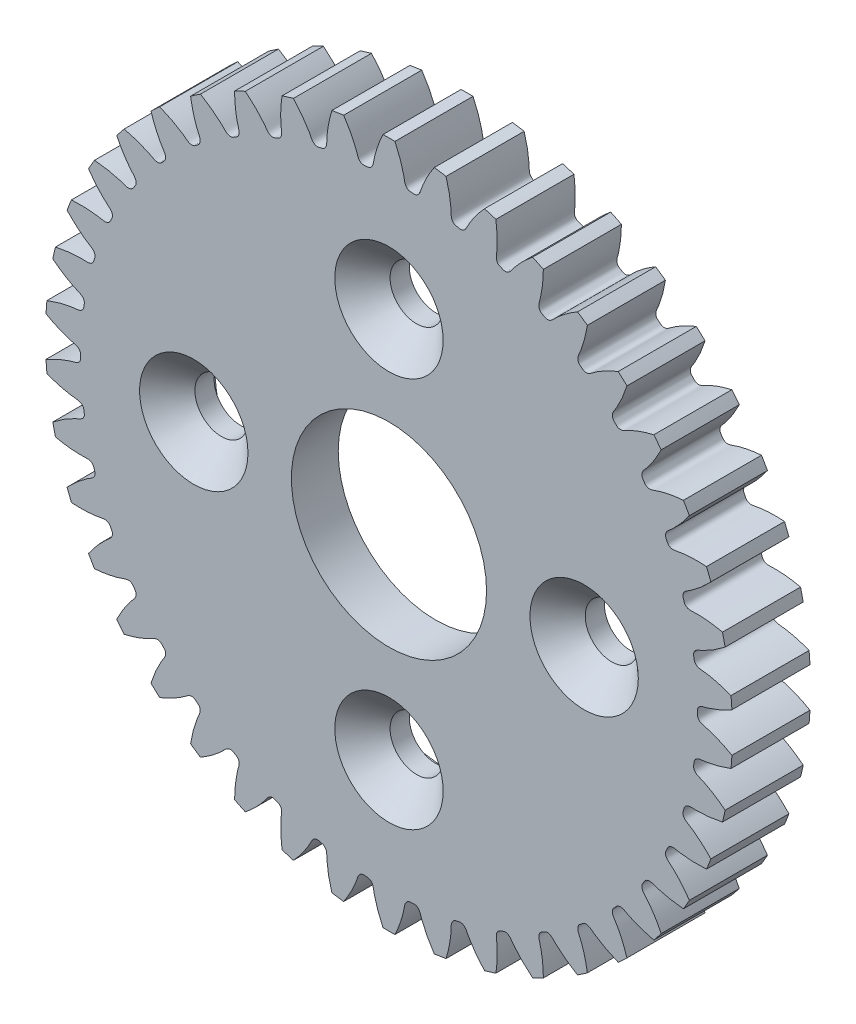
from build123d import *

# Parameters (mm, degrees)
SKETCHREVOLVESPURASSEM30_42M1GEAR_W                  = 5
SKETCHREVOLVESPURASSEM30_42M1GEAR_H                  = 21.99999967
TOOTHEXTRUDECUTSPURASSEM30_42M1GEAR_DEPTH            = 2.5
PATTERNSPURASSEM30_42M1GEAR_COUNT                    = 42
BOREREVOLVESKETCH_W                                  = 5
BOREREVOLVESKETCH_H                                  = 2.5
SKETCH1_R                                            = 16.25
CUT_EXTRUDE1_DEPTH                                   = 2
CSK_FOR_M3_HEX_SOCKET_COUNTERSUNK_HEAD_S_D           = 3.4
CSK_FOR_M3_HEX_SOCKET_COUNTERSUNK_HEAD_S_CSINK_D     = 6.94
CSK_FOR_M3_HEX_SOCKET_COUNTERSUNK_HEAD_S_CSINK_ANGLE = 90
SKETCH5_R                                            = 6.25
CUT_EXTRUDE2_DEPTH                                   = 10


with BuildPart() as part:
    # SketchRevolveSpurAssem30-42M1Gear → SpurAssem30-42M1Gear (revolve)
    with BuildSketch(Plane(origin=(0, 0, 0), x_dir=(0, 0, -1), z_dir=(1, 0, 0))):
        with Locations((0, 10.999999835)):
            Rectangle(SKETCHREVOLVESPURASSEM30_42M1GEAR_W, SKETCHREVOLVESPURASSEM30_42M1GEAR_H)
    revolve(axis=Axis((0, 0, 0), (0, 0, -1)))

    # SketchToothSpurAssem30-42M1Gear → ToothExtrudeCutSpurAssem30-42M1Gear (cut, symmetric)
    with BuildSketch(Plane.XY):
        with BuildLine():
            ThreePointArc((22.012204329, 1.290482841), (22.049999669, 0), (22.012204329, -1.290482841))
            add(Edge.make_bspline(
                [(22.012204329, -1.290482841), (21.876881108, -1.212822529), (21.697227009, -1.115288897), (21.472744948, -1.003295421), (21.346878269, -0.943103461), (21.225027009, -0.887311022), (21.107301637, -0.835766704), (20.993808633, -0.788316506), (20.884650449, -0.744804243), (20.77992562, -0.705071004), (20.679728119, -0.668957316), (20.584149398, -0.636296104), (20.493271151, -0.606937334), (20.407189954, -0.580663937), (20.325933009, -0.557479079), (20.219834275, -0.528448103), (20.131314711, -0.509898503), (20.062502592, -0.487621837), (20.038788179, -0.479087282), (20.015326461, -0.469707059), (19.992008128, -0.459327052), (19.968709335, -0.447745292), (19.945300303, -0.434691469), (19.921656157, -0.419807128), (19.897680911, -0.402621255), (19.873351059, -0.382527416), (19.848789832, -0.358773864), (19.824379798, -0.330491642), (19.800910497, -0.296804215), (19.779698186, -0.257064706), (19.762623676, -0.211248216), (19.752137914, -0.162467212), (19.747914734, -0.091373905), (19.751466405, 0), (19.747914734, 0.091373905), (19.752137914, 0.162467212), (19.762623676, 0.211248216), (19.779698186, 0.257064706), (19.800910497, 0.296804215), (19.824379798, 0.330491642), (19.848789832, 0.358773864), (19.873351059, 0.382527416), (19.897680911, 0.402621255), (19.921656157, 0.419807128), (19.945300303, 0.434691469), (19.968709335, 0.447745292), (19.992008128, 0.459327052), (20.015326461, 0.469707059), (20.038788179, 0.479087282), (20.062502592, 0.487621837), (20.131314711, 0.509898503), (20.219834275, 0.528448103), (20.325933009, 0.557479079), (20.407189954, 0.580663937), (20.493271151, 0.606937334), (20.584149398, 0.636296104), (20.679728119, 0.668957316), (20.77992562, 0.705071004), (20.884650449, 0.744804243), (20.993808633, 0.788316506), (21.107301637, 0.835766704), (21.225027009, 0.887311022), (21.346878269, 0.943103461), (21.472744948, 1.003295421), (21.697227009, 1.115288897), (21.876881108, 1.212822529), (22.012204329, 1.290482841)],
                knots=[0, 0, 0, 0, 0.085044452, 0.11139392, 0.13674371, 0.161093824, 0.184444261, 0.206795022, 0.228146106, 0.248497513, 0.267849243, 0.286201297, 0.303553674, 0.319906374, 0.335259397, 0.349612744, 0.379870476, 0.384459086, 0.38902841, 0.393606937, 0.398229383, 0.402938177, 0.407785204, 0.412833691, 0.418159951, 0.423854234, 0.430019255, 0.436763802, 0.444187693, 0.452354477, 0.461252798, 0.47075873, 0.479429807, 0.5, 0.520570193, 0.52924127, 0.538747202, 0.547645523, 0.555812307, 0.563236198, 0.569980745, 0.576145766, 0.581840049, 0.587166309, 0.592214796, 0.597061823, 0.601770617, 0.606393063, 0.61097159, 0.615540914, 0.620129524, 0.650387256, 0.664740603, 0.680093626, 0.696446326, 0.713798703, 0.732150757, 0.751502487, 0.771853894, 0.793204978, 0.815555739, 0.838906176, 0.86325629, 0.88860608, 0.914955548, 1, 1, 1, 1], degree=3))
        make_face()
    toothextrudecutspurassem30_42m1gear = extrude(amount=TOOTHEXTRUDECUTSPURASSEM30_42M1GEAR_DEPTH, both=True, mode=Mode.SUBTRACT)

    # PatternSpurAssem30-42M1Gear: ToothExtrudeCutSpurAssem30-42M1Gear ×42 about axis
    patternspurassem30_42m1gear_axis = Axis((0, 0, 55), (0, 0, -1))
    for i in range(1, PATTERNSPURASSEM30_42M1GEAR_COUNT):
        add(toothextrudecutspurassem30_42m1gear.rotate(patternspurassem30_42m1gear_axis, i * 360 / PATTERNSPURASSEM30_42M1GEAR_COUNT), mode=Mode.SUBTRACT)

    # BoreRevolveSketch → BoreRevolveCut (revolve, cut)
    with BuildSketch(Plane(origin=(0, 0, 0), x_dir=(0, 0, -1), z_dir=(1, 0, 0))):
        with Locations((0, 1.25)):
            Rectangle(BOREREVOLVESKETCH_W, BOREREVOLVESKETCH_H)
    revolve(axis=Axis((0, 0, 0), (0, 0, -1)), mode=Mode.SUBTRACT)

    # Sketch1 → Cut-Extrude1 (cut)
    with BuildSketch(Plane(origin=(0, 0, -2.5), x_dir=(-1, 0, 0), z_dir=(0, 0, -1))):
        Circle(SKETCH1_R)
    extrude(amount=-CUT_EXTRUDE1_DEPTH, mode=Mode.SUBTRACT)

    # CSK for M3 Hex Socket Countersunk Head Screw1 (through all)
    with Locations(Plane.XY.offset(2.5)):
        with Locations((0, 12.5), (-12.5, 0), (0, -12.5), (12.5, 0)):
            CounterSinkHole(CSK_FOR_M3_HEX_SOCKET_COUNTERSUNK_HEAD_S_D / 2, CSK_FOR_M3_HEX_SOCKET_COUNTERSUNK_HEAD_S_CSINK_D / 2, counter_sink_angle=CSK_FOR_M3_HEX_SOCKET_COUNTERSUNK_HEAD_S_CSINK_ANGLE)

    # Sketch5 → Cut-Extrude2 (cut)
    with BuildSketch(Plane.XY.offset(2.5)):
        Circle(SKETCH5_R)
    extrude(amount=-CUT_EXTRUDE2_DEPTH, mode=Mode.SUBTRACT)


solid = part.part
